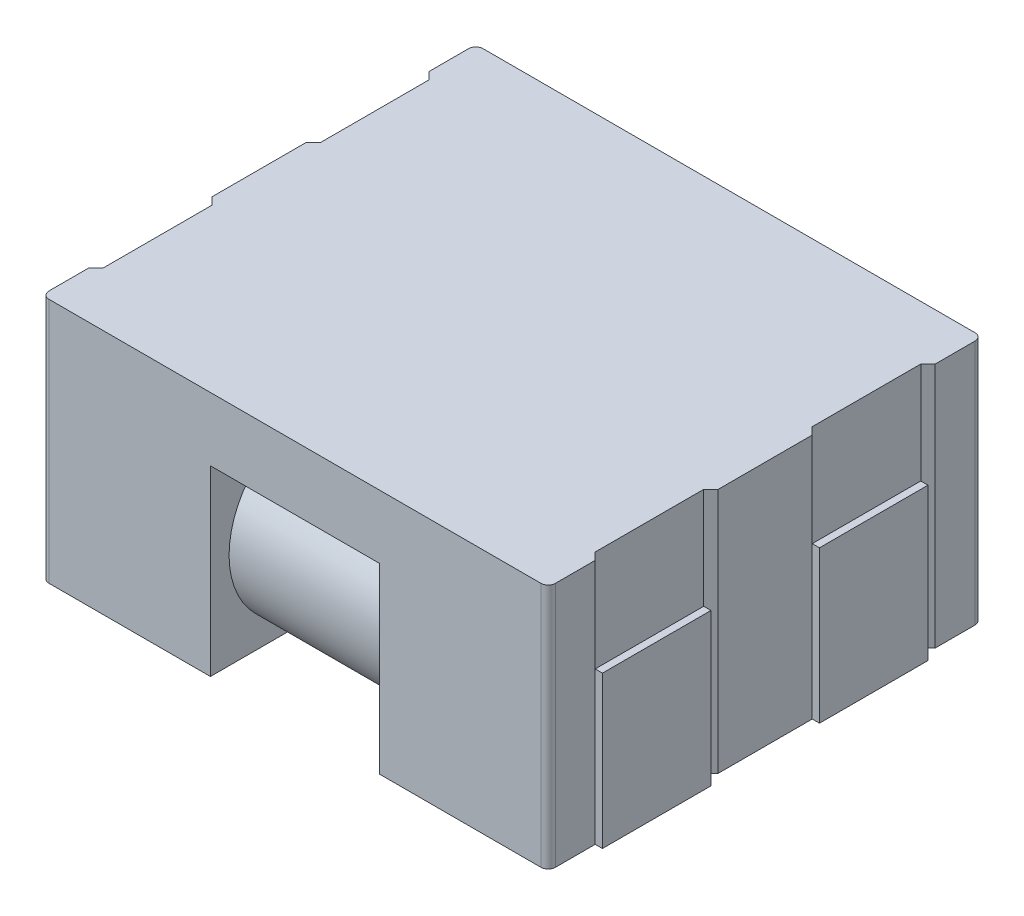
from build123d import *

# Parameters (mm, degrees)
SKETCH2_W             = 1.5
SKETCH2_H             = 1.5
BOSS_EXTRUDE1_DEPTH   = 0.1
BOSS_EXTRUDE1_2_DEPTH = 0.1
BOSS_EXTRUDE1_3_DEPTH = 0.1
BOSS_EXTRUDE1_4_DEPTH = 0.1
BOSS_EXTRUDE2_START   = 0.1
SKETCH5_W             = 7
SKETCH5_H             = 6
BOSS_EXTRUDE2_DEPTH   = 3.4
SKETCH6_W             = 0.1
SKETCH6_H             = 1.5
CUT_EXTRUDE1_DEPTH    = 3.4
SKETCH7_W             = 0.1
SKETCH7_H             = 1.5
BOSS_EXTRUDE4_DEPTH   = 2
BOSS_EXTRUDE4_2_DEPTH = 2
BOSS_EXTRUDE4_3_DEPTH = 2
BOSS_EXTRUDE4_4_DEPTH = 2
CHAMFER1_SIZE         = 0.1
FILLET1_R             = 0.1
SKETCH8_W             = 2.33676434
SKETCH8_H             = 2.522890168
CUT_EXTRUDE2_DEPTH    = 10.861541462
SKETCH9_R             = 1.242296886
BOSS_EXTRUDE5_DEPTH   = 2.336762
BOSS_EXTRUDE5_2_DEPTH = 2.336762
SKETCH10_R            = 1.242296886
BOSS_EXTRUDE6_DEPTH   = 2.336764
BOSS_EXTRUDE6_2_DEPTH = 2.336764


with BuildPart() as part:
    # Sketch2 → Boss-Extrude1 (new body)
    with BuildSketch(Plane(origin=(0, 0, 0), x_dir=(1, 0, 0), z_dir=(0, 1, 0))):
        with Locations((6.25, 4.5)):
            Rectangle(SKETCH2_W, SKETCH2_H)
    extrude(amount=BOSS_EXTRUDE1_DEPTH)


with BuildPart() as body_2:
    # Sketch2 → Boss-Extrude1 2 (new body)
    with BuildSketch(Plane(origin=(0, 0, 0), x_dir=(1, 0, 0), z_dir=(0, 1, 0))):
        with Locations((0.75, 4.5)):
            Rectangle(SKETCH2_W, SKETCH2_H)
    extrude(amount=BOSS_EXTRUDE1_2_DEPTH)


with BuildPart() as body_3:
    # Sketch2 → Boss-Extrude1 3 (new body)
    with BuildSketch(Plane(origin=(0, 0, 0), x_dir=(1, 0, 0), z_dir=(0, 1, 0))):
        with Locations((6.25, 1.5)):
            Rectangle(SKETCH2_W, SKETCH2_H)
    extrude(amount=BOSS_EXTRUDE1_3_DEPTH)


with BuildPart() as body_4:
    # Sketch2 → Boss-Extrude1 4 (new body)
    with BuildSketch(Plane(origin=(0, 0, 0), x_dir=(1, 0, 0), z_dir=(0, 1, 0))):
        with Locations((0.75, 1.5)):
            Rectangle(SKETCH2_W, SKETCH2_H)
    extrude(amount=BOSS_EXTRUDE1_4_DEPTH)


with BuildPart() as body_5:
    # Sketch5 → Boss-Extrude2 (new body)
    with BuildSketch(Plane(origin=(0, 0, 0), x_dir=(1, 0, 0), z_dir=(0, 1, 0)).offset(BOSS_EXTRUDE2_START)):
        with Locations((3.5, 3)):
            Rectangle(SKETCH5_W, SKETCH5_H)
    extrude(amount=BOSS_EXTRUDE2_DEPTH)

    # Sketch6 → Cut-Extrude1 (cut)
    with BuildSketch(Plane(origin=(0, 3.5, 0), x_dir=(1, 0, 0), z_dir=(0, 1, 0))):
        with Locations((6.95, 1.5)):
            Rectangle(SKETCH6_W, SKETCH6_H)
        with Locations((6.95, 4.5)):
            Rectangle(SKETCH6_W, SKETCH6_H)
        with Locations((0.05, 4.5)):
            Rectangle(SKETCH6_W, SKETCH6_H)
        with Locations((0.05, 1.5)):
            Rectangle(SKETCH6_W, SKETCH6_H)
    extrude(amount=-CUT_EXTRUDE1_DEPTH, mode=Mode.SUBTRACT)

    # Chamfer1
    chamfer1_edges = [body_5.edges().sort_by_distance(p)[0] for p in [
        (0, 1.8, -0.75),
        (0, 1.8, -2.25),
        (0, 1.8, -3.75),
        (0, 1.8, -5.25),
        (7, 1.8, -5.25),
        (7, 1.8, -0.75),
        (7, 1.8, -3.75),
        (7, 1.8, -2.25),
    ]]
    chamfer(chamfer1_edges, length=CHAMFER1_SIZE - 0.0001)  # a hair under: the kernel refuses the full size

    # Fillet1
    fillet1_edges = [body_5.edges().sort_by_distance(p)[0] for p in [
        (0, 1.8, 0),
        (7, 1.8, 0),
        (7, 1.8, -6),
        (0, 1.8, -6),
    ]]
    fillet(fillet1_edges, radius=FILLET1_R)

    # Sketch8 → Cut-Extrude2 (cut, through all)
    with BuildSketch(Plane.XY):
        with Locations((3.5, 1.361445084)):
            Rectangle(SKETCH8_W, SKETCH8_H)
    extrude(amount=-CUT_EXTRUDE2_DEPTH, mode=Mode.SUBTRACT)


with BuildPart() as body_6:
    # Sketch7 → Boss-Extrude4 (new body)
    with BuildSketch(Plane(origin=(0, 0.1, 0), x_dir=(1, 0, 0), z_dir=(0, 1, 0))):
        with Locations((6.95, 1.5)):
            Rectangle(SKETCH7_W, SKETCH7_H)
    extrude(amount=BOSS_EXTRUDE4_DEPTH)


with BuildPart() as body_7:
    # Sketch7 → Boss-Extrude4 2 (new body)
    with BuildSketch(Plane(origin=(0, 0.1, 0), x_dir=(1, 0, 0), z_dir=(0, 1, 0))):
        with Locations((6.95, 4.5)):
            Rectangle(SKETCH7_W, SKETCH7_H)
    extrude(amount=BOSS_EXTRUDE4_2_DEPTH)


with BuildPart() as body_8:
    # Sketch7 → Boss-Extrude4 3 (new body)
    with BuildSketch(Plane(origin=(0, 0.1, 0), x_dir=(1, 0, 0), z_dir=(0, 1, 0))):
        with Locations((0.05, 1.5)):
            Rectangle(SKETCH7_W, SKETCH7_H)
    extrude(amount=BOSS_EXTRUDE4_3_DEPTH)

    # Combine1: union body 4
    add(body_4.part)


with BuildPart() as body_9:
    # Sketch7 → Boss-Extrude4 4 (new body)
    with BuildSketch(Plane(origin=(0, 0.1, 0), x_dir=(1, 0, 0), z_dir=(0, 1, 0))):
        with Locations((0.05, 4.5)):
            Rectangle(SKETCH7_W, SKETCH7_H)
    extrude(amount=BOSS_EXTRUDE4_4_DEPTH)


with BuildPart() as body_2_1:
    add(body_2.part)

    # Combine2: union body 9
    add(body_9.part)


with BuildPart() as part_1:
    add(part.part)

    # Combine3: union body 7
    add(body_7.part)


with BuildPart() as body_3_1:
    add(body_3.part)

    # Combine4: union body 6
    add(body_6.part)


with BuildPart() as body_6_2:
    # Sketch9 → Boss-Extrude5 (new body)
    with BuildSketch(Plane.ZY.offset(-4.66838217)):
        with Locations(Location((-1.5, 1.422890168, 0), (0, 0, 180))):
            Circle(SKETCH9_R)
    extrude(amount=BOSS_EXTRUDE5_DEPTH)


with BuildPart() as body_7_2:
    # Sketch9 → Boss-Extrude5 2 (new body)
    with BuildSketch(Plane.ZY.offset(-4.66838217)):
        with Locations(Location((-4.5, 1.422890168, 0), (0, 0, 180))):
            Circle(SKETCH9_R)
    extrude(amount=BOSS_EXTRUDE5_2_DEPTH)


with BuildPart() as body_5_1:
    add(body_5.part)

    # Combine6: cut body 6 2, body 7 2
    add(body_6_2.part, mode=Mode.SUBTRACT)
    add(body_7_2.part, mode=Mode.SUBTRACT)


with BuildPart() as body_6_3:
    # Sketch10 → Boss-Extrude6 (new body)
    with BuildSketch(Plane(origin=(2.33161783, 0, 0), x_dir=(0, 0, -1), z_dir=(1, 0, 0))):
        with Locations(Location((1.5, 1.422890168, 0), (0, 0, 180))):
            Circle(SKETCH10_R)
    extrude(amount=BOSS_EXTRUDE6_DEPTH)


with BuildPart() as body_7_3:
    # Sketch10 → Boss-Extrude6 2 (new body)
    with BuildSketch(Plane(origin=(2.33161783, 0, 0), x_dir=(0, 0, -1), z_dir=(1, 0, 0))):
        with Locations(Location((4.5, 1.422890168, 0), (0, 0, 180))):
            Circle(SKETCH10_R)
    extrude(amount=BOSS_EXTRUDE6_2_DEPTH)


solid = Compound([body_8.part, body_2_1.part, part_1.part, body_3_1.part, body_5_1.part, body_6_3.part, body_7_3.part])
